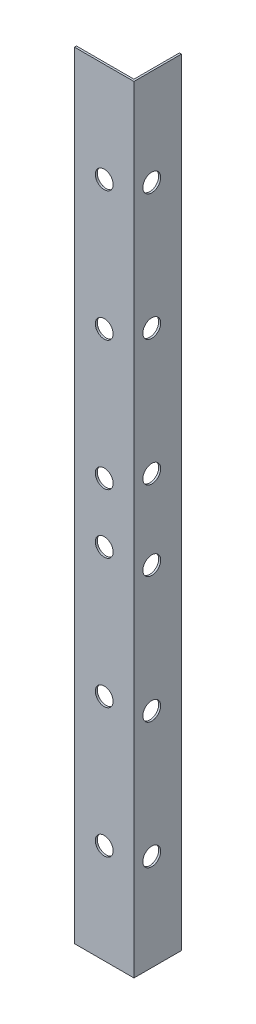
from build123d import *

# Parameters (mm, degrees)
BOSS_EXTRUDE1_DEPTH = 196
CUT_EXTRUDE4_REACH  = 198.939
SKETCH5_R           = 2.25
CUT_EXTRUDE5_REACH  = 198.939
SKETCH6_R           = 2.25


with BuildPart() as part:
    # Sketch1 → Boss-Extrude1 (new body)
    with BuildSketch(Plane(origin=(0, 0, 0), x_dir=(1, 0, 0), z_dir=(0, 1, 0))):
        Polygon((0, 0), (15, 0), (15, 12), (14.5, 12), (14.5, 0.5), (0, 0.5), align=None)
    extrude(amount=BOSS_EXTRUDE1_DEPTH)

    # Sketch5 → Cut-Extrude4 (cut, up to next)
    with BuildSketch(Plane(origin=(15, 0, 0), x_dir=(0, 0, -1), z_dir=(1, 0, 0)), mode=Mode.PRIVATE) as cut_extrude4_sk1:
        with Locations((4.5, 24.333333333)):
            Circle(SKETCH5_R)
    cut_extrude4_tool1 = extrude(cut_extrude4_sk1.sketch, amount=-CUT_EXTRUDE4_REACH, mode=Mode.PRIVATE) & part.part
    # Sketch5 → Cut-Extrude4 (cut, up to next)
    with BuildSketch(Plane(origin=(15, 0, 0), x_dir=(0, 0, -1), z_dir=(1, 0, 0)), mode=Mode.PRIVATE) as cut_extrude4_sk2:
        with Locations((4.5, 56.166666667)):
            Circle(SKETCH5_R)
    cut_extrude4_tool2 = extrude(cut_extrude4_sk2.sketch, amount=-CUT_EXTRUDE4_REACH, mode=Mode.PRIVATE) & part.part
    # Sketch5 → Cut-Extrude4 (cut, up to next)
    with BuildSketch(Plane(origin=(15, 0, 0), x_dir=(0, 0, -1), z_dir=(1, 0, 0)), mode=Mode.PRIVATE) as cut_extrude4_sk3:
        with Locations((4.5, 88)):
            Circle(SKETCH5_R)
    cut_extrude4_tool3 = extrude(cut_extrude4_sk3.sketch, amount=-CUT_EXTRUDE4_REACH, mode=Mode.PRIVATE) & part.part
    # Sketch5 → Cut-Extrude4 (cut, up to next)
    with BuildSketch(Plane(origin=(15, 0, 0), x_dir=(0, 0, -1), z_dir=(1, 0, 0)), mode=Mode.PRIVATE) as cut_extrude4_sk4:
        with Locations((4.5, 108)):
            Circle(SKETCH5_R)
    cut_extrude4_tool4 = extrude(cut_extrude4_sk4.sketch, amount=-CUT_EXTRUDE4_REACH, mode=Mode.PRIVATE) & part.part
    # Sketch5 → Cut-Extrude4 (cut, up to next)
    with BuildSketch(Plane(origin=(15, 0, 0), x_dir=(0, 0, -1), z_dir=(1, 0, 0)), mode=Mode.PRIVATE) as cut_extrude4_sk5:
        with Locations((4.5, 139.833333333)):
            Circle(SKETCH5_R)
    cut_extrude4_tool5 = extrude(cut_extrude4_sk5.sketch, amount=-CUT_EXTRUDE4_REACH, mode=Mode.PRIVATE) & part.part
    # Sketch5 → Cut-Extrude4 (cut, up to next)
    with BuildSketch(Plane(origin=(15, 0, 0), x_dir=(0, 0, -1), z_dir=(1, 0, 0)), mode=Mode.PRIVATE) as cut_extrude4_sk6:
        with Locations((4.5, 171.666666667)):
            Circle(SKETCH5_R)
    cut_extrude4_tool6 = extrude(cut_extrude4_sk6.sketch, amount=-CUT_EXTRUDE4_REACH, mode=Mode.PRIVATE) & part.part
    add(cut_extrude4_tool1.solids().sort_by_distance((15, 24.333333, -4.5))[0], mode=Mode.SUBTRACT)
    add(cut_extrude4_tool2.solids().sort_by_distance((15, 56.166667, -4.5))[0], mode=Mode.SUBTRACT)
    add(cut_extrude4_tool3.solids().sort_by_distance((15, 88, -4.5))[0], mode=Mode.SUBTRACT)
    add(cut_extrude4_tool4.solids().sort_by_distance((15, 108, -4.5))[0], mode=Mode.SUBTRACT)
    add(cut_extrude4_tool5.solids().sort_by_distance((15, 139.833333, -4.5))[0], mode=Mode.SUBTRACT)
    add(cut_extrude4_tool6.solids().sort_by_distance((15, 171.666667, -4.5))[0], mode=Mode.SUBTRACT)

    # Sketch6 → Cut-Extrude5 (cut, up to next)
    with BuildSketch(Plane.XY, mode=Mode.PRIVATE) as cut_extrude5_sk1:
        with Locations((7.5, 25.166666667)):
            Circle(SKETCH6_R)
    cut_extrude5_tool1 = extrude(cut_extrude5_sk1.sketch, amount=-CUT_EXTRUDE5_REACH, mode=Mode.PRIVATE) & part.part
    # Sketch6 → Cut-Extrude5 (cut, up to next)
    with BuildSketch(Plane.XY, mode=Mode.PRIVATE) as cut_extrude5_sk2:
        with Locations((7.5, 57.833333333)):
            Circle(SKETCH6_R)
    cut_extrude5_tool2 = extrude(cut_extrude5_sk2.sketch, amount=-CUT_EXTRUDE5_REACH, mode=Mode.PRIVATE) & part.part
    # Sketch6 → Cut-Extrude5 (cut, up to next)
    with BuildSketch(Plane.XY, mode=Mode.PRIVATE) as cut_extrude5_sk3:
        with Locations((7.5, 90.5)):
            Circle(SKETCH6_R)
    cut_extrude5_tool3 = extrude(cut_extrude5_sk3.sketch, amount=-CUT_EXTRUDE5_REACH, mode=Mode.PRIVATE) & part.part
    # Sketch6 → Cut-Extrude5 (cut, up to next)
    with BuildSketch(Plane.XY, mode=Mode.PRIVATE) as cut_extrude5_sk4:
        with Locations((7.5, 105.5)):
            Circle(SKETCH6_R)
    cut_extrude5_tool4 = extrude(cut_extrude5_sk4.sketch, amount=-CUT_EXTRUDE5_REACH, mode=Mode.PRIVATE) & part.part
    # Sketch6 → Cut-Extrude5 (cut, up to next)
    with BuildSketch(Plane.XY, mode=Mode.PRIVATE) as cut_extrude5_sk5:
        with Locations((7.5, 138.166666667)):
            Circle(SKETCH6_R)
    cut_extrude5_tool5 = extrude(cut_extrude5_sk5.sketch, amount=-CUT_EXTRUDE5_REACH, mode=Mode.PRIVATE) & part.part
    # Sketch6 → Cut-Extrude5 (cut, up to next)
    with BuildSketch(Plane.XY, mode=Mode.PRIVATE) as cut_extrude5_sk6:
        with Locations((7.5, 170.833333333)):
            Circle(SKETCH6_R)
    cut_extrude5_tool6 = extrude(cut_extrude5_sk6.sketch, amount=-CUT_EXTRUDE5_REACH, mode=Mode.PRIVATE) & part.part
    add(cut_extrude5_tool1.solids().sort_by_distance((7.5, 25.166667, 0))[0], mode=Mode.SUBTRACT)
    add(cut_extrude5_tool2.solids().sort_by_distance((7.5, 57.833333, 0))[0], mode=Mode.SUBTRACT)
    add(cut_extrude5_tool3.solids().sort_by_distance((7.5, 90.5, 0))[0], mode=Mode.SUBTRACT)
    add(cut_extrude5_tool4.solids().sort_by_distance((7.5, 105.5, 0))[0], mode=Mode.SUBTRACT)
    add(cut_extrude5_tool5.solids().sort_by_distance((7.5, 138.166667, 0))[0], mode=Mode.SUBTRACT)
    add(cut_extrude5_tool6.solids().sort_by_distance((7.5, 170.833333, 0))[0], mode=Mode.SUBTRACT)


solid = part.part
